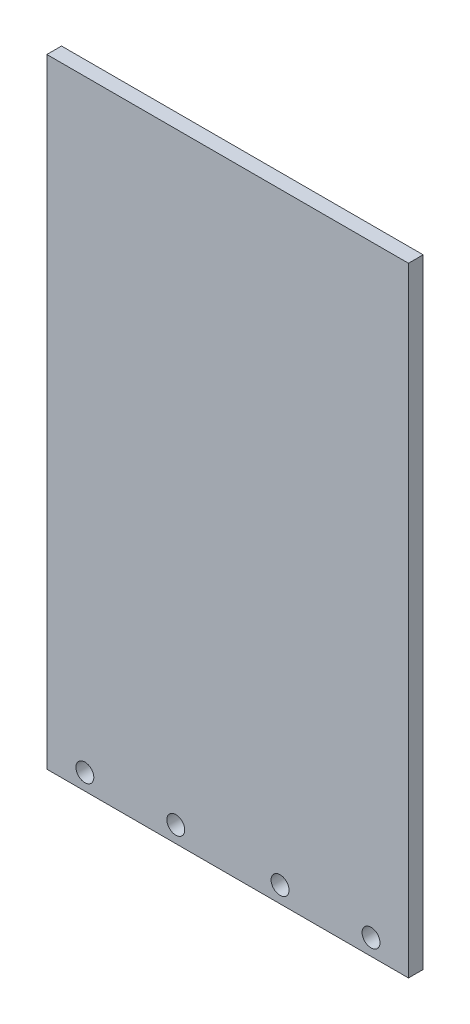
from build123d import *

# Parameters (mm, degrees)
SKETCH1_W           = 222
SKETCH1_H           = 380
BOSS_EXTRUDE1_DEPTH = 9
SKETCH4_R           = 5.5
CUT_EXTRUDE2_DEPTH  = 221.231696175


with BuildPart() as part:
    # Sketch1 → Boss-Extrude1 (new body)
    with BuildSketch(Plane.XY):
        Rectangle(SKETCH1_W, SKETCH1_H)
    extrude(amount=BOSS_EXTRUDE1_DEPTH)

    # Sketch4 → Cut-Extrude2 (cut, through all)
    with BuildSketch(Plane(origin=(0, 0, 0), x_dir=(-1, 0, 0), z_dir=(0, 0, -1))):
        with Locations((-32.16, -180)):
            Circle(SKETCH4_R)
        with Locations((-88, -180)):
            Circle(SKETCH4_R)
        with Locations((31.84, -180)):
            Circle(SKETCH4_R)
        with Locations((87.68, -180)):
            Circle(SKETCH4_R)
    extrude(amount=-CUT_EXTRUDE2_DEPTH, mode=Mode.SUBTRACT)


solid = part.part
